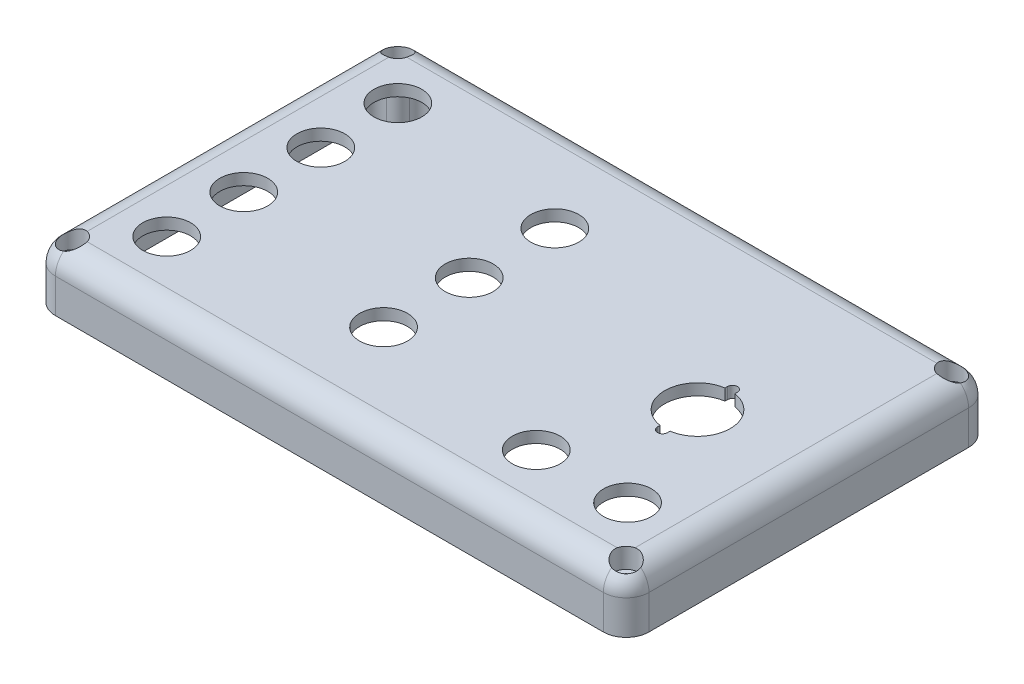
from build123d import *

# Parameters (mm, degrees)
SKETCH1_W            = 208
SKETCH1_H            = 128
SKETCH1_W_2          = 200
SKETCH1_H_2          = 120
SKETCH1_W_3          = 8
SKETCH1_H_3          = 8
BOSS_EXTRUDE1_DEPTH  = 16
SKETCH1_3_W          = 208
SKETCH1_3_H          = 128
SKETCH1_3_R          = 8.4
BOSS_EXTRUDE2_DEPTH  = 4
M4_CLEARANCE_HOLE1_D = 4.8
FILLET2_R            = 8
FILLET1_R            = 4
FILLET3_R            = 8
FILLET4_R            = 3
SKETCH8_R            = 4.25
CUT_EXTRUDE1_DEPTH   = 7


# Some blends are built 0.0001 mm under size
with BuildPart() as part:
    # Sketch1 → Boss-Extrude1 (new body)
    # profile 1 of 5: a face of its own
    with BuildSketch(Plane(origin=(0, 0, 0), x_dir=(1, 0, 0), z_dir=(0, 1, 0))):
        with Locations((100, 60)):
            Rectangle(SKETCH1_W, SKETCH1_H)
        with Locations((100, 60)):
            Rectangle(SKETCH1_W_2, SKETCH1_H_2, mode=Mode.SUBTRACT)
    # profile 2 of 5: a face of its own
    with BuildSketch(Plane(origin=(0, 0, 0), x_dir=(1, 0, 0), z_dir=(0, 1, 0))):
        with Locations((4, 4)):
            Rectangle(SKETCH1_W_3, SKETCH1_H_3)
    # profile 3 of 5: a face of its own
    with BuildSketch(Plane(origin=(0, 0, 0), x_dir=(1, 0, 0), z_dir=(0, 1, 0))):
        with Locations((196, 4)):
            Rectangle(SKETCH1_W_3, SKETCH1_H_3)
    # profile 4 of 5: a face of its own
    with BuildSketch(Plane(origin=(0, 0, 0), x_dir=(1, 0, 0), z_dir=(0, 1, 0))):
        with Locations((196, 116)):
            Rectangle(SKETCH1_W_3, SKETCH1_H_3)
    # profile 5 of 5: a face of its own
    with BuildSketch(Plane(origin=(0, 0, 0), x_dir=(1, 0, 0), z_dir=(0, 1, 0))):
        with Locations((4, 116)):
            Rectangle(SKETCH1_W_3, SKETCH1_H_3)
    extrude(amount=-BOSS_EXTRUDE1_DEPTH)

    # Sketch1<3> → Boss-Extrude2 (add)
    with BuildSketch(Plane(origin=(0, 0, 0), x_dir=(1, 0, 0), z_dir=(0, 1, 0))):
        with Locations((100, 60)):
            Rectangle(SKETCH1_3_W, SKETCH1_3_H)
        with Locations(Location((85, 90, 0), (0, 0, 270))):
            Circle(SKETCH1_3_R, mode=Mode.SUBTRACT)
        with Locations(Location((19.5, 100.5, 0), (0, 0, 270))):
            Circle(SKETCH1_3_R, mode=Mode.SUBTRACT)
        with Locations(Location((19.5, 19.5, 0), (0, 0, 270))):
            Circle(SKETCH1_3_R, mode=Mode.SUBTRACT)
        with Locations(Location((19.5, 46.5, 0), (0, 0, 270))):
            Circle(SKETCH1_3_R, mode=Mode.SUBTRACT)
        with Locations(Location((85, 30, 0), (0, 0, 270))):
            Circle(SKETCH1_3_R, mode=Mode.SUBTRACT)
        with Locations(Location((85, 60, 0), (0, 0, 270))):
            Circle(SKETCH1_3_R, mode=Mode.SUBTRACT)
        with Locations(Location((149, 19.5, 0), (0, 0, 270))):
            Circle(SKETCH1_3_R, mode=Mode.SUBTRACT)
        with Locations(Location((181, 19.5, 0), (0, 0, 270))):
            Circle(SKETCH1_3_R, mode=Mode.SUBTRACT)
        with BuildLine():
            ThreePointArc((163.25, 48.633932078), (153.5, 60), (163.25, 71.366067922))
            Line((163.25, 71.366067922), (163.25, 72.25))
            ThreePointArc((163.25, 72.25), (165, 74), (166.75, 72.25))
            Line((166.75, 72.25), (166.75, 71.366067922))
            ThreePointArc((166.75, 71.366067922), (176.5, 60), (166.75, 48.633932078))
            Line((166.75, 48.633932078), (166.75, 47.75))
            ThreePointArc((166.75, 47.75), (165, 46), (163.25, 47.75))
            Line((163.25, 47.75), (163.25, 48.633932078))
        make_face(mode=Mode.SUBTRACT)
        with Locations(Location((19.5, 73.5, 0), (0, 0, 270))):
            Circle(SKETCH1_3_R, mode=Mode.SUBTRACT)
    extrude(amount=BOSS_EXTRUDE2_DEPTH)

    # M4 Clearance Hole1 (through all)
    with Locations(Plane(origin=(0, 4, 0), x_dir=(1, 0, 0), z_dir=(0, 1, 0))):
        with Locations((3, 117), (197, 3), (3, 3), (197, 117)):
            Hole(M4_CLEARANCE_HOLE1_D / 2)

    # Fillet2
    fillet2_edges = [part.edges().sort_by_distance(p)[0] for p in [
        (204, -6, 4),
        (-4, -6, 4),
        (-4, -6, -124),
        (204, -6, -124),
    ]]
    fillet(fillet2_edges, radius=FILLET2_R)

    # Fillet1
    fillet1_edges = [part.edges().sort_by_distance(p)[0] for p in [
        (192, -8, 0),
        (192, -8, -8),
        (200, -8, -8),
        (8, -8, 0),
        (8, -8, -8),
        (0, -8, -8),
        (0, -8, -112),
        (8, -8, -120),
        (8, -8, -112),
        (192, -8, -120),
        (192, -8, -112),
        (200, -8, -112),
    ]]
    fillet(fillet1_edges, radius=FILLET1_R - 0.0001)  # a hair under: the kernel refuses the full size

    # Fillet3
    # the kernel refuses this fillet: 8 mm, written as the material it takes off along each edge
    with BuildSketch(Plane(origin=(-4, 4, -116), x_dir=(0, -1, 0), z_dir=(0, 0, 1)), Plane(origin=(204, 4, -4), x_dir=(0, -1, 0), z_dir=(0, 0, -1))) as fillet3_piece_1:
        with BuildLine():
            CenterArc((FILLET3_R, FILLET3_R), FILLET3_R, 180, 90)
            Line((0, FILLET3_R), (0, 0))
            Line((0, 0), (FILLET3_R, 0))
        make_face()
    extrude(amount=112, mode=Mode.SUBTRACT)
    with BuildSketch(Plane(origin=(196, 4, -124), x_dir=(0, -1, 0), z_dir=(-1, 0, 0)), Plane(origin=(4, 4, 4), x_dir=(0, -1, 0), z_dir=(1, 0, 0))) as fillet3_piece_2:
        with BuildLine():
            CenterArc((FILLET3_R, FILLET3_R), FILLET3_R, 180, 90)
            Line((0, FILLET3_R), (0, 0))
            Line((0, 0), (FILLET3_R, 0))
        make_face()
    extrude(amount=192, mode=Mode.SUBTRACT)
    with BuildSketch(Plane(origin=(4, 4, -4), x_dir=(0, 0, 1), z_dir=(1, 0, 0))) as fillet3_piece_3:
        with BuildLine():
            CenterArc((8 - FILLET3_R, FILLET3_R), FILLET3_R, 270, 90)
            Line((8 - FILLET3_R, 0), (8, 0))
            Line((8, 0), (8, FILLET3_R))
        make_face()
    revolve(axis=Axis((4, 4, -4), (0, -1, 0)), revolution_arc=90, mode=Mode.SUBTRACT)
    with BuildSketch(Plane(origin=(196, 4, -4), x_dir=(1, 0, 0), z_dir=(0, 0, -1))) as fillet3_piece_4:
        with BuildLine():
            CenterArc((8 - FILLET3_R, FILLET3_R), FILLET3_R, 270, 90)
            Line((8 - FILLET3_R, 0), (8, 0))
            Line((8, 0), (8, FILLET3_R))
        make_face()
    revolve(axis=Axis((196, 4, -4), (0, -1, 0)), revolution_arc=90, mode=Mode.SUBTRACT)
    with BuildSketch(Plane(origin=(196, 4, -116), x_dir=(1, 0, 0), z_dir=(0, 0, 1))) as fillet3_piece_5:
        with BuildLine():
            CenterArc((8 - FILLET3_R, -FILLET3_R), FILLET3_R, 0, 90)
            Line((8 - FILLET3_R, 0), (8, 0))
            Line((8, 0), (8, -FILLET3_R))
        make_face()
    revolve(axis=Axis((196, 4, -116), (0, 1, 0)), revolution_arc=90, mode=Mode.SUBTRACT)
    with BuildSketch(Plane(origin=(4, 4, -116), x_dir=(0, 0, -1), z_dir=(1, 0, 0))) as fillet3_piece_6:
        with BuildLine():
            CenterArc((8 - FILLET3_R, -FILLET3_R), FILLET3_R, 0, 90)
            Line((8 - FILLET3_R, 0), (8, 0))
            Line((8, 0), (8, -FILLET3_R))
        make_face()
    revolve(axis=Axis((4, 4, -116), (0, 1, 0)), revolution_arc=90, mode=Mode.SUBTRACT)

    # Fillet4
    fillet4_edges = [part.edges().sort_by_distance(p)[0] for p in [
        (200, 0, -60),
        (100, 0, 0),
        (0, 0, -60),
        (100, 0, -120),
        (198.828456414, 0, -110.828456414),
        (190.828456414, 0, -118.828456414),
        (9.171543586, 0, -118.828456414),
        (1.171543586, 0, -110.828456414),
        (1.171543586, 0, -9.171543586),
        (9.171543586, 0, -1.171543586),
        (198.828456414, 0, -9.171543586),
        (190.828456414, 0, -1.171543586),
        (193.171543586, 0, -6.828456414),
        (6.828456414, 0, -6.828456414),
        (6.828456414, 0, -113.171543586),
        (193.171543586, 0, -113.171543586),
    ]]
    fillet(fillet4_edges, radius=FILLET4_R)

    # Sketch8 → Cut-Extrude1 (cut)
    with BuildSketch(Plane(origin=(0, 4, 0), x_dir=(1, 0, 0), z_dir=(0, 1, 0))):
        with Locations(Location((3, 117, 0), (0, 0, 270))):
            Circle(SKETCH8_R)
        with Locations(Location((197, 117, 0), (0, 0, 270))):
            Circle(SKETCH8_R)
        with Locations(Location((197, 3, 0), (0, 0, 270))):
            Circle(SKETCH8_R)
        with Locations(Location((3, 3, 0), (0, 0, 270))):
            Circle(SKETCH8_R)
    extrude(amount=-CUT_EXTRUDE1_DEPTH, mode=Mode.SUBTRACT)


solid = part.part
